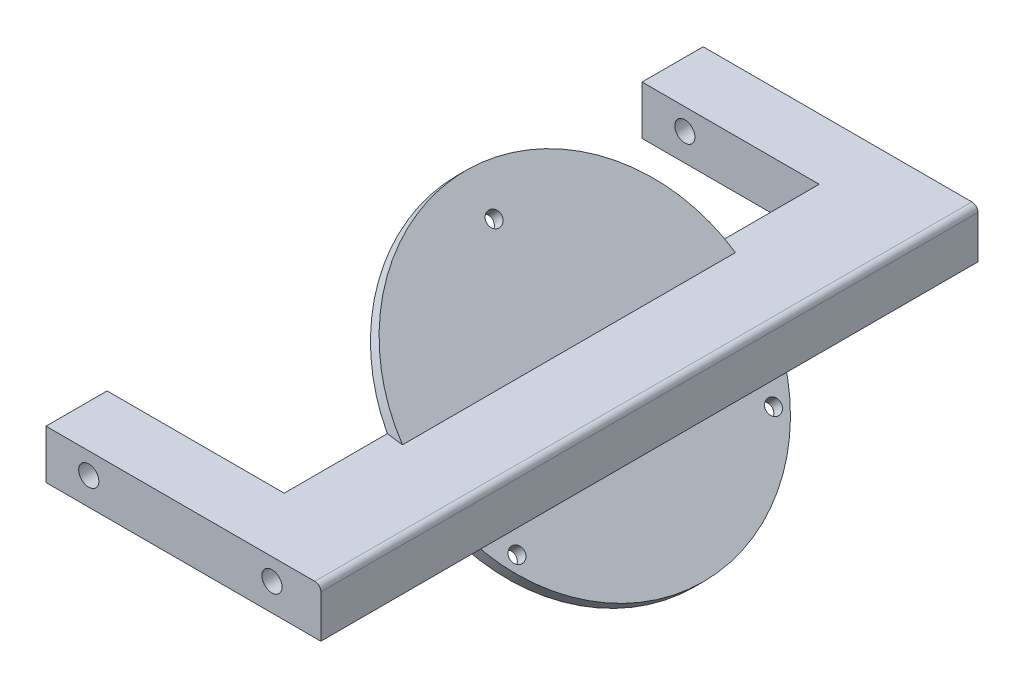
from build123d import *

# Parameters (mm, degrees)
BASE_DEPTH                 = 53.8
SKETCH4_R                  = 27.5
BOSS_EXTRUDE2_DEPTH        = 2
M2_CLEARANCE_HOLE1_D       = 2.4
FILLET1_R                  = 0.5
SIDE_HOLES_D               = 3.3
SIDE_ARM_DEPTH             = 10
F_3_3_3_3_DIAMETER_HOLE1_D = 3.3
FILLET2_R                  = 1


with BuildPart() as part:
    # Sketch1 → Base (new, symmetric)
    with BuildSketch(Plane.XY):
        Polygon((8, 4), (-8, 4), (0, -4), (8, -4), align=None)
    extrude(amount=BASE_DEPTH, both=True)

    # Sketch4 → Boss-Extrude2 (add)
    with BuildSketch(Plane(origin=(-2, -2, 0), x_dir=(0, 0, 1), z_dir=(-0.7071067811865475, -0.7071067811865476, 0))):
        with Locations((0, 2.828427125)):
            Circle(SKETCH4_R)
    extrude(amount=-BOSS_EXTRUDE2_DEPTH)

    # M2 Clearance Hole1 (through all)
    with Locations(Plane(origin=(-0.585786438, -0.585786438, 0), x_dir=(0.7071067811865475, -0.7071067811865477, 0), z_dir=(0.7071067811865477, 0.7071067811865475, 0))):
        with Locations((-23.828427125, 0), (11.171572875, 21), (11.171572875, -21)):
            Hole(M2_CLEARANCE_HOLE1_D / 2)

    # Sketch8 → Revolve1 (revolve)
    with BuildSketch(Plane(origin=(-2, 2, 0), x_dir=(0, 0, 1), z_dir=(0.7071067811865437, -0.7071067811865515, 0))):
        with BuildLine():
            Line((0, 3.828427125), (0, 2.828427125))
            Line((0, 2.828427125), (-12, 2.828427125))
            Line((-12, 2.828427125), (-6.5, 10.328427125))
            ThreePointArc((-6.5, 10.328427125), (-4.596194078, 5.732233047), (0, 3.828427125))
        make_face()
    revolve(axis=Axis((-4, 0, 0), (-0.7071067811865515, -0.7071067811865437, 0)))

    # Fillet1
    fillet1_edges = [part.edges().sort_by_distance(p)[0] for p in [
        (-9.303300859, -5.303300859, 6.5),
    ]]
    fillet(fillet1_edges, radius=FILLET1_R)

    # Side Holes (through all)
    with Locations(Plane.XY.offset(53.8)):
        with Locations((0, 0.5)):
            Hole(SIDE_HOLES_D / 2)

    # Sketch9 → Side Arm (add)
    with BuildSketch(Plane.XY.offset(53.8)):
        Polygon((-8, 4), (0, -4), (-37, -4), (-37, 4), align=None)
    side_arm = extrude(amount=-SIDE_ARM_DEPTH)

    # Mirror1: Side Arm across plane
    add(side_arm.mirror(Plane.XY))

    # Ø3.3 (3.3) Diameter Hole1 (through all)
    with Locations(Plane.XY.offset(53.8)):
        with Locations((-30, 0.5)):
            Hole(F_3_3_3_3_DIAMETER_HOLE1_D / 2)

    # Fillet2
    fillet2_edges = [part.edges().sort_by_distance(p)[0] for p in [
        (8, 4, 0),
    ]]
    fillet(fillet2_edges, radius=FILLET2_R)


solid = part.part
